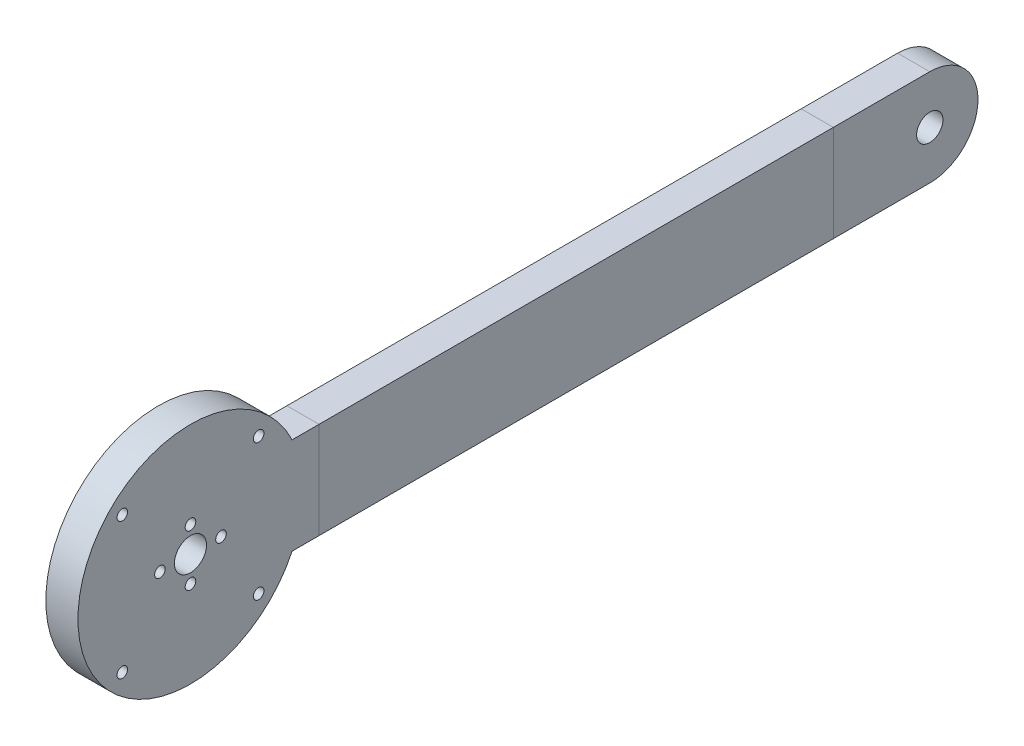
from build123d import *

# Parameters (mm, degrees)
BOSS_EXTRUDE1_DEPTH = 10
SKETCH2_R           = 4.1
CUT_EXTRUDE1_DEPTH  = 246.662369931
SKETCH3_R           = 1.5
CUT_EXTRUDE2_DEPTH  = 246.662369931
SKETCH4_R           = 5
CUT_EXTRUDE3_DEPTH  = 246.662369931
BOSS_EXTRUDE2_START = -10
SKETCH5_R           = 35
SKETCH5_R_2         = 15
BOSS_EXTRUDE2_DEPTH = 10
SKETCH6_R           = 1.65
CUT_EXTRUDE4_DEPTH  = 268.488317502
CHAMFER3_SIZE       = 1.5
SKETCH7_R           = 1.65
CUT_EXTRUDE5_DEPTH  = 268.488317502
SPLIT1_OUTLINE_R    = 4.1
SPLIT1_DEPTH        = 10
SPLIT1_START        = -15
SPLIT1_2_OUTLINE_W  = 10
SPLIT1_2_OUTLINE_H  = 30
SPLIT1_2_DEPTH      = 205
SPLIT1_START_2      = 30
SPLIT1_3_OUTLINE_W  = 10
SPLIT1_3_OUTLINE_H  = 30
SPLIT1_3_DEPTH      = 160


# Read off the part's stored shape, not the designer's step: Split1
with BuildPart() as part:
    # Sketch1 → Boss-Extrude1 (new body)
    with BuildSketch(Plane.YZ):
        with BuildLine():
            Line((-15, 0), (-15, 230))
            ThreePointArc((-15, 230), (0, 245), (15, 230))
            Line((15, 230), (15, 0))
            ThreePointArc((15, 0), (0, -15), (-15, 0))
        make_face()
    extrude(amount=BOSS_EXTRUDE1_DEPTH)

    # Sketch2 → Cut-Extrude1 (cut, through all)
    with BuildSketch(Plane.YZ.offset(10)):
        with Locations(Location((0, 0, 0), (0, 0, 270))):
            Circle(SKETCH2_R)
    extrude(amount=-CUT_EXTRUDE1_DEPTH, mode=Mode.SUBTRACT)

    # Sketch3 → Cut-Extrude2 (cut, through all)
    with BuildSketch(Plane.YZ.offset(10)):
        with Locations(Location((0, 239.5, 0), (0, 0, 270))):
            Circle(SKETCH3_R)
        with Locations(Location((8, 230, 0), (0, 0, 270))):
            Circle(SKETCH3_R)
        with Locations(Location((-8, 230, 0), (0, 0, 270))):
            Circle(SKETCH3_R)
        with Locations(Location((0, 220.5, 0), (0, 0, 270))):
            Circle(SKETCH3_R)
    extrude(amount=-CUT_EXTRUDE2_DEPTH, mode=Mode.SUBTRACT)

    # Sketch4 → Cut-Extrude3 (cut, through all)
    with BuildSketch(Plane.YZ.offset(10)):
        with Locations(Location((0, 230, 0), (0, 0, 270))):
            Circle(SKETCH4_R)
    extrude(amount=-CUT_EXTRUDE3_DEPTH, mode=Mode.SUBTRACT)

    # Sketch5 → Boss-Extrude2 (add)
    with BuildSketch(Plane.YZ.offset(10).offset(BOSS_EXTRUDE2_START)):
        with Locations((0, 230)):
            Circle(SKETCH5_R)
        with Locations((0, 230)):
            Circle(SKETCH5_R_2, mode=Mode.SUBTRACT)
    extrude(amount=BOSS_EXTRUDE2_DEPTH)

    # Sketch6 → Cut-Extrude4 (cut, through all)
    with BuildSketch(Plane.YZ.offset(10)):
        with Locations(Location((-21.213203436, 251.213203436, 0), (0, 0, 270))):
            Circle(SKETCH6_R)
        with Locations(Location((21.213203436, 251.213203436, 0), (0, 0, 270))):
            Circle(SKETCH6_R)
        with Locations(Location((21.213203436, 208.786796564, 0), (0, 0, 270))):
            Circle(SKETCH6_R)
        with Locations(Location((-21.213203436, 208.786796564, 0), (0, 0, 270))):
            Circle(SKETCH6_R)
    extrude(amount=-CUT_EXTRUDE4_DEPTH, mode=Mode.SUBTRACT)

    # Chamfer3
    chamfer3_edges = [part.edges().sort_by_distance(p)[0] for p in [
        (0, 0, 241),
        (0, 8, 231.5),
        (0, -8, 231.5),
        (0, 0, 222),
    ]]
    chamfer(chamfer3_edges, length=CHAMFER3_SIZE - 0.0001)  # a hair under: the kernel refuses the full size

    # Sketch7 → Cut-Extrude5 (cut, through all)
    with BuildSketch(Plane(origin=(0, 0, 0), x_dir=(0, -1, 0), z_dir=(-1, 0, 0))):
        with Locations(Location((0, 239.5, 0), (0, 0, 90))):
            Circle(SKETCH7_R)
        with Locations(Location((8, 230, 0), (0, 0, 90))):
            Circle(SKETCH7_R)
        with Locations(Location((0, 220.5, 0), (0, 0, 90))):
            Circle(SKETCH7_R)
        with Locations(Location((-8, 230, 0), (0, 0, 90))):
            Circle(SKETCH7_R)
    extrude(amount=-CUT_EXTRUDE5_DEPTH, mode=Mode.SUBTRACT)

    # Split1 2 outline → Split1 2 (cut)
    with BuildSketch(Plane.XY.offset(SPLIT1_START)):
        with Locations((5, 0)):
            Rectangle(SPLIT1_2_OUTLINE_W, SPLIT1_2_OUTLINE_H)
    extrude(amount=SPLIT1_2_DEPTH, mode=Mode.SUBTRACT)


with BuildPart() as body_2:
    # Split1 outline → Split1 (new body)
    with BuildSketch(Plane.YZ):
        with BuildLine():
            Line((15, 0), (15, 30))
            Line((15, 30), (-15, 30))
            Line((-15, 30), (-15, 0))
            ThreePointArc((-15, 0), (0, -15), (15, 0))
        make_face()
        Circle(SPLIT1_OUTLINE_R, mode=Mode.SUBTRACT)
    extrude(amount=SPLIT1_DEPTH)


with BuildPart() as body_3:
    # Split1 3 outline → Split1 3 (new body)
    with BuildSketch(Plane.XY.offset(SPLIT1_START_2)):
        with Locations((5, 0)):
            Rectangle(SPLIT1_3_OUTLINE_W, SPLIT1_3_OUTLINE_H)
    extrude(amount=SPLIT1_3_DEPTH)


solid = Compound([part.part, body_2.part, body_3.part])
